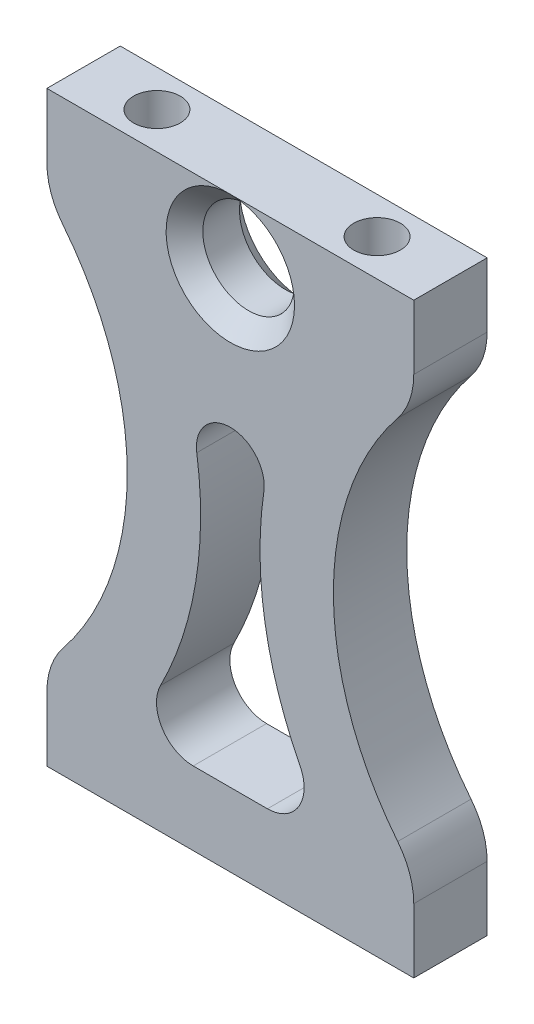
from build123d import *

# Parameters (mm, degrees)
BOSS_EXTRUDE1_DEPTH                = 6.35
F_10_32_TAPPED_HOLE1_AT_2_COUNT    = 2
F_10_32_TAPPED_HOLE1_AT_2_PITCH    = 19.05
F_5_16_0_3125_DIAMETER_HOLE1_D     = 7.9375
F_5_16_0_3125_DIAMETER_HOLE1_DEPTH = 10.668
F_5_16_0_3125_DIAMETER_HOLE1_TIP   = 2.38466558176563
CHAMFER1_SIZE                      = 1.5875
CUT_EXTRUDE1_DEPTH                 = 31.61859116615264
FILLET1_R                          = 6.35
CUT_EXTRUDE2_DEPTH                 = 31.61859116615264
FILLET2_R                          = 3.175
FILLET3_DEPTH                      = 6.35


with BuildPart() as part:
    # Sketch1 → Boss-Extrude1 (new body)
    with BuildSketch(Plane.XY):
        Polygon((-15.875000000000007, 25.400000000000006), (15.874999999999993, 25.400000000000006), (15.875, -25.39999999999999), (-15.875, -25.39999999999999), align=None)
    extrude(amount=BOSS_EXTRUDE1_DEPTH)

    # Sketch3 → #10-32 Tapped Hole1 (revolve, cut)
    with BuildSketch(Plane(origin=(-9.525000000000007, 25.400000000000006, 3.175000000000004), x_dir=(0, 0, 1), z_dir=(1, 0, 0))):
        Polygon((0, 0), (-2.66e-15, 10.865317848002352), (2.0192999999999977, 9.652), (2.0192999999999985, 4e-17), align=None)
    f_10_32_tapped_hole1 = revolve(axis=Axis((-9.525000000000007, 31.749999999999996, 3.175000000000004), (0, -1, 0)), mode=Mode.SUBTRACT)

    # #10-32 Tapped Hole1 at 2: #10-32 Tapped Hole1 ×2
    with Locations(*[(i * F_10_32_TAPPED_HOLE1_AT_2_PITCH, 0, 0) for i in range(1, F_10_32_TAPPED_HOLE1_AT_2_COUNT)]):
        add(f_10_32_tapped_hole1, mode=Mode.SUBTRACT)

    # 5/16 (0.3125) Diameter Hole1
    with Locations(Plane.XY.offset(6.35)):
        with Locations((0, 19.84375)):
            Hole(F_5_16_0_3125_DIAMETER_HOLE1_D / 2, depth=F_5_16_0_3125_DIAMETER_HOLE1_DEPTH)
            with Locations((0, 0, -(F_5_16_0_3125_DIAMETER_HOLE1_DEPTH + F_5_16_0_3125_DIAMETER_HOLE1_TIP / 2))):  # 118° drill point
                Cone(0, F_5_16_0_3125_DIAMETER_HOLE1_D / 2, F_5_16_0_3125_DIAMETER_HOLE1_TIP, mode=Mode.SUBTRACT)

    # Chamfer1
    chamfer1_edges = [part.edges().sort_by_distance(p)[0] for p in [
        (3.96875, 19.84375, 0),
        (3.96875, 19.84375, 6.35),
    ]]
    chamfer(chamfer1_edges, length=CHAMFER1_SIZE)

    # Sketch6 → Cut-Extrude1 (cut, through all)
    with BuildSketch(Plane.XY.offset(6.35)):
        with BuildLine():
            Line((-15.875000000000007, 17.462500000000006), (-15.875000000000007, 3.55e-15))
            Line((-15.875000000000007, 3.39e-15), (-8.92008318631283, 4.67e-15))
            ThreePointArc((-8.920083186312826, 3.5971e-13), (-10.722783415657506, 9.398268113531895), (-15.875000000000007, 17.462500000000006))
        make_face()
        with BuildLine():
            Line((-8.92008318631283, 4.67e-15), (-15.875000000000007, 3.39e-15))
            Line((-15.875000000000007, 3.55e-15), (-15.875000000000007, -17.462500000000006))
            ThreePointArc((-15.87500000000001, -17.46250000000001), (-10.722783415657375, -9.39826811353156), (-8.920083186312826, 3.5971e-13))
        make_face()
        with BuildLine():
            ThreePointArc((15.875000000000004, 17.462499999999984), (10.722783415657386, 9.39826811353155), (8.920083186312844, -3.4461e-13))
            Line((8.920083186312851, 7.94e-15), (15.875, 9.22e-15))
            Line((15.875000000000004, 1.066e-14), (15.875000000000004, 17.462499999999984))
        make_face()
        with BuildLine():
            Line((15.875, 9.22e-15), (8.920083186312851, 7.94e-15))
            ThreePointArc((8.920083186312844, -3.4461e-13), (10.722783415657513, -9.398268113531874), (15.875, -17.462499999999984))
            Line((15.875000000000004, -17.462499999999984), (15.875000000000004, 1.066e-14))
        make_face()
    extrude(amount=-CUT_EXTRUDE1_DEPTH, mode=Mode.SUBTRACT)

    # Fillet1
    fillet1_edges = [part.edges().sort_by_distance(p)[0] for p in [
        (15.875000000000002, -17.462499999999984, 3.175),
        (15.875000000000004, 17.462499999999984, 3.175),
        (-15.875000000000009, -17.46250000000001, 3.175),
        (-15.875000000000005, 17.462500000000006, 3.175),
    ]]
    fillet(fillet1_edges, radius=FILLET1_R)

    # Sketch7 → Cut-Extrude2 (cut, through all)
    with BuildSketch(Plane.XY.offset(6.35)):
        with BuildLine():
            Line((-8.92008318631281, -19.04999999999999), (8.920083186312835, -19.049999999999986))
            ThreePointArc((8.920083186312835, -19.049999999999986), (3.1152594113270133, -5.858453138165378), (3.7402393989355516, 8.540237346795667))
            ThreePointArc((3.7402393989355516, 8.540237346795667), (6.02e-15, 7.937499999999989), (-3.740239398935539, 8.540237346795662))
            ThreePointArc((-3.740239398935539, 8.540237346795662), (-3.1152594113270027, -5.858453138165384), (-8.92008318631281, -19.04999999999999))
        make_face()
    extrude(amount=-CUT_EXTRUDE2_DEPTH, mode=Mode.SUBTRACT)

    # Fillet2
    fillet2_edges = [part.edges().sort_by_distance(p)[0] for p in [
        (8.920083186312837, -19.049999999999986, 3.175),
        (-8.920083186312809, -19.04999999999999, 3.175),
    ]]
    fillet(fillet2_edges, radius=FILLET2_R)

    # Mirror1: #10-32 Tapped Hole1 across plane
    add(f_10_32_tapped_hole1.mirror(Plane.ZX), mode=Mode.SUBTRACT)

    # Mirror1 copy 1 sketch → Mirror1 copy 1 (revolve, cut)
    with BuildSketch(Plane(origin=(9.524999999999993, -25.400000000000006, 3.175000000000004), x_dir=(0, 0, 1), z_dir=(1, 0, 0))):
        Polygon((0, 0), (-2.66e-15, -10.865317848002352), (2.0192999999999977, -9.652), (2.0192999999999985, -4e-17), align=None)
    revolve(axis=Axis((9.524999999999993, -31.749999999999996, 3.175000000000004), (0, -1, 0)), mode=Mode.SUBTRACT)

    # Fillet3: read off the stored shape, not the designer's step
    # Fillet3 outline → Fillet3 (add)
    with BuildSketch(Plane.XY):
        with BuildLine():
            ThreePointArc((-3.740239399, 8.540237347), (-3.258151648, 6.574108997), (-2.902339746, 4.581254969))
            add(Edge.make_bspline(
                [(-2.902339746, 4.581254969), (-3.0109534907888404, 5.326116105248684), (-2.9047701826802874, 6.25797221448604), (-2.3933426209054938, 7.245588905615834), (-1.356695523735085, 7.937499999999987), (0, 7.9375)],
                knots=[0, 0, 0, 0, 0, 0, 0.5, 0.5, 0.5, 0.5, 0.5, 0.5], degree=5, weights=[1, 0.7711417009817829, 0.5994979767181202, 0.48506882720901173, 0.4278542524544575, 0.4278542524544575]))
            ThreePointArc((0, 7.9375), (-1.894246762, 8.089150123), (-3.740239399, 8.540237347))
        make_face()
        with BuildLine():
            ThreePointArc((3.740239399, 8.540237347), (1.894246748, 8.089150121), (-1.5e-08, 7.9375))
            add(Edge.make_bspline(
                [(-1.5e-08, 7.9375), (1.3566955237351, 7.937499999999984), (2.393342620905507, 7.245588905615829), (2.904770182680299, 6.257972214486036), (3.01095349078885, 5.326116105248681), (2.902339746, 4.581254969)],
                knots=[0.5, 0.5, 0.5, 0.5, 0.5, 0.5, 1, 1, 1, 1, 1, 1], degree=5, weights=[0.4278542524544575, 0.4278542524544575, 0.48506882720901173, 0.5994979767181202, 0.7711417009817829, 1]))
            ThreePointArc((2.902339746, 4.581254969), (3.258151648, 6.574108997), (3.740239399, 8.540237347))
        make_face()
    extrude(amount=FILLET3_DEPTH)


solid = part.part
